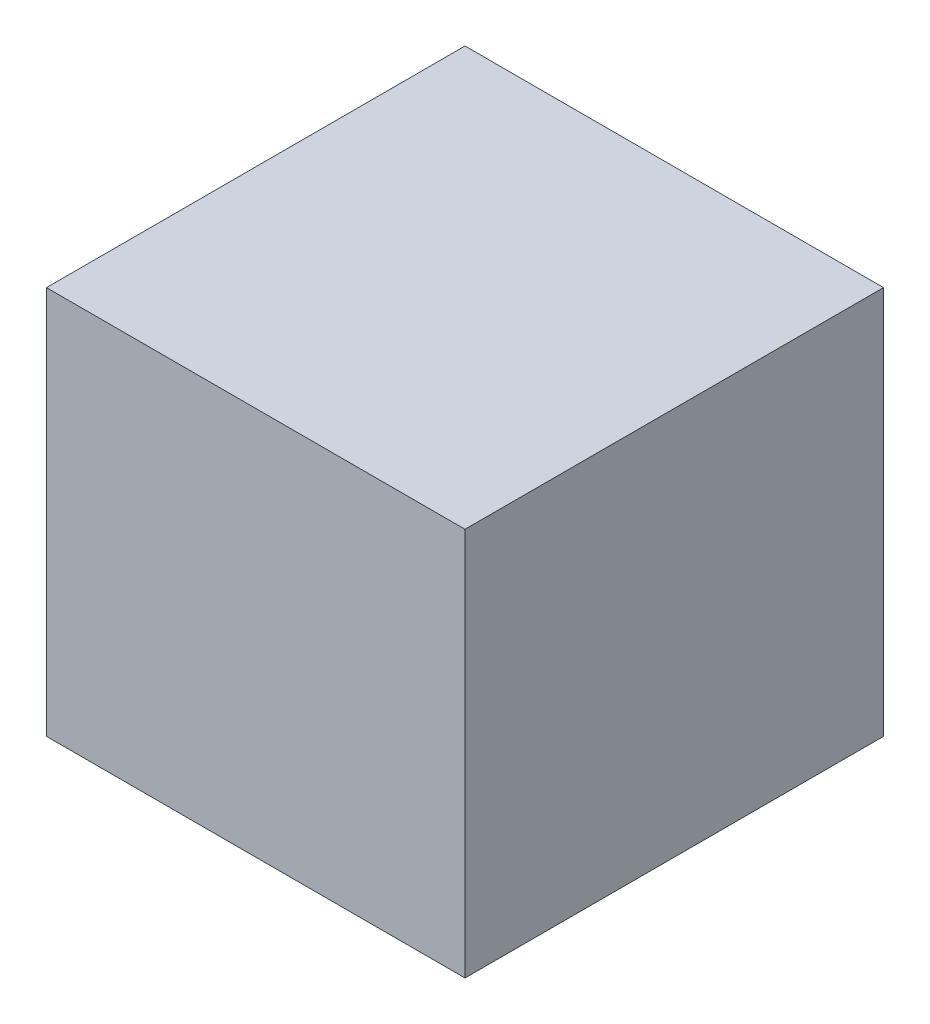
from build123d import *

# Parameters (mm, degrees)
ESQUISSE1_W        = 42
ESQUISSE1_H        = 42
BOSS_EXTRU_1_DEPTH = 39


with BuildPart() as part:
    # Esquisse1 → Boss.-Extru.1 (new body)
    with BuildSketch(Plane(origin=(0, 0, 0), x_dir=(1, 0, 0), z_dir=(0, 1, 0))):
        Rectangle(ESQUISSE1_W, ESQUISSE1_H)
    extrude(amount=BOSS_EXTRU_1_DEPTH)


solid = part.part
